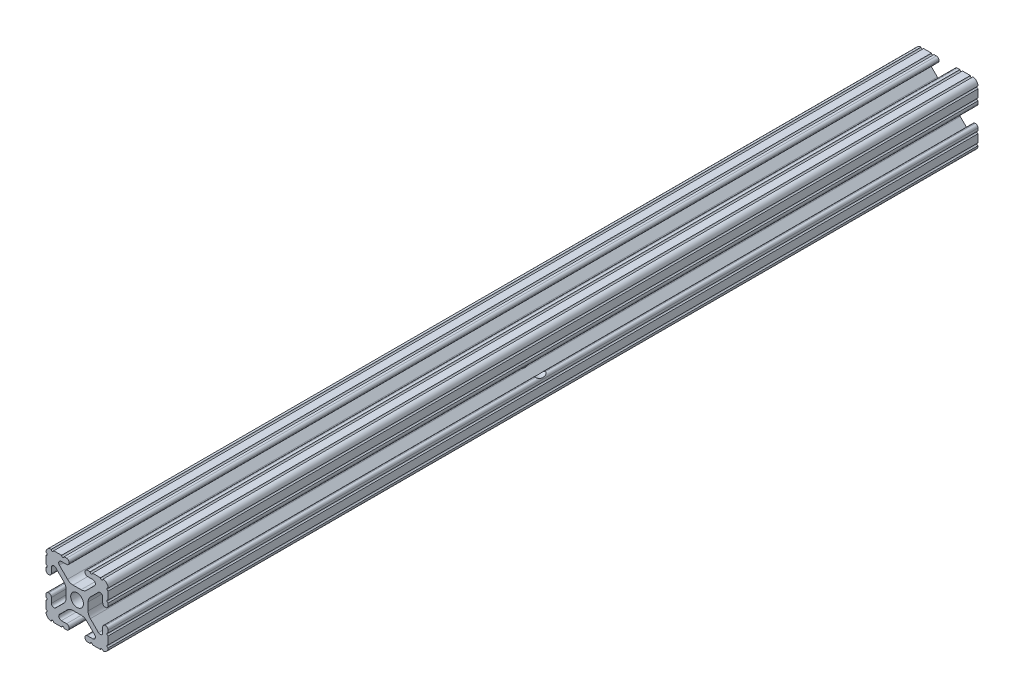
from build123d import *

# Parameters (mm, degrees)
SKETCH1_R               = 2.6035
BOSS_EXTRUDE1_DEPTH     = 177.8
SKETCH2_R               = 3.81
CUT_EXTRUDE1_DEPTH      = 25.4
CUT_EXTRUDE2_DEPTH      = 180.080500267
CUT_EXTRUDE2_DEPTH_BACK = 180.080500267
SKETCH3_R               = 3.175


with BuildPart() as part:
    # Sketch1 → Boss-Extrude1 (new, symmetric)
    with BuildSketch(Plane.XY):
        with BuildLine():
            Line((-7.179650497, -8.645192506), (-3.952270251, -5.423690499))
            ThreePointArc((-3.952270251, -5.423690499), (-2.922936451, -4.736929036), (-1.709253557, -4.4958))
            Line((-1.709253557, -4.4958), (1.709253557, -4.4958))
            ThreePointArc((1.709253557, -4.4958), (2.922936451, -4.736929036), (3.952270251, -5.423690499))
            Line((3.952270251, -5.423690499), (7.179650497, -8.645192506))
            ThreePointArc((7.179650497, -8.645192506), (7.41473083, -9.822813117), (6.416408329, -10.4902))
            Line((6.416408329, -10.4902), (4.287512407, -10.4902))
            ThreePointArc((4.287512407, -10.4902), (3.54574862, -10.79744862), (3.2385, -11.539212407))
            Line((3.2385, -11.539212407), (3.2385, -11.650987593))
            ThreePointArc((3.2385, -11.650987593), (3.54574862, -12.39275138), (4.287512407, -12.7))
            Line((4.287512407, -12.7), (5.317126718, -12.7))
            ThreePointArc((5.317126718, -12.7), (5.825126718, -12.192), (6.333126718, -12.7))
            Line((6.333126718, -12.7), (9.550443118, -12.7))
            ThreePointArc((9.550443118, -12.7), (10.058366869, -12.192000006), (10.566443095, -12.699847501))
            ThreePointArc((10.566443095, -12.699847501), (12.082537762, -12.08250727), (12.699846982, -10.566399977))
            ThreePointArc((12.699846982, -10.566399977), (12.192000006, -10.058323491), (12.7, -9.5504))
            Line((12.7, -9.5504), (12.7, -6.3330836))
            ThreePointArc((12.7, -6.3330836), (12.192, -5.8250836), (12.7, -5.3170836))
            Line((12.7, -5.3170836), (12.7, -4.287469289))
            ThreePointArc((12.7, -4.287469289), (12.39275138, -3.545705502), (11.650987593, -3.238456882))
            Line((11.650987593, -3.238456882), (11.539212407, -3.238456882))
            ThreePointArc((11.539212407, -3.238456882), (10.79744862, -3.545705502), (10.4902, -4.287469289))
            Line((10.4902, -4.287469289), (10.4902, -6.402089023))
            ThreePointArc((10.4902, -6.402089023), (9.856505071, -7.351067942), (8.737131347, -7.129408934))
            Line((8.737131347, -7.129408934), (5.441005833, -3.840816462))
            ThreePointArc((5.441005833, -3.840816462), (4.750877967, -2.809883091), (4.5085, -1.593185507))
            Line((4.5085, -1.593185507), (4.5085, 1.593185507))
            ThreePointArc((4.5085, 1.593185507), (4.750877967, 2.809883091), (5.441005833, 3.840816462))
            Line((5.441005833, 3.840816462), (8.737131347, 7.129408934))
            ThreePointArc((8.737131347, 7.129408934), (9.856505071, 7.351067942), (10.4902, 6.402089023))
            Line((10.4902, 6.402089023), (10.4902, 4.287469289))
            ThreePointArc((10.4902, 4.287469289), (10.79744862, 3.545705502), (11.539212407, 3.238456882))
            Line((11.539212407, 3.238456882), (11.650987593, 3.238456882))
            ThreePointArc((11.650987593, 3.238456882), (12.39275138, 3.545705502), (12.7, 4.287469289))
            Line((12.7, 4.287469289), (12.7, 5.3170836))
            ThreePointArc((12.7, 5.3170836), (12.192, 5.8250836), (12.7, 6.3330836))
            Line((12.7, 6.3330836), (12.7, 9.5504))
            ThreePointArc((12.7, 9.5504), (12.192000006, 10.058323491), (12.699846982, 10.566399977))
            ThreePointArc((12.699846982, 10.566399977), (12.082537762, 12.08250727), (10.566443095, 12.699847501))
            ThreePointArc((10.566443095, 12.699847501), (10.058366869, 12.192000006), (9.550443118, 12.7))
            Line((9.550443118, 12.7), (6.333126718, 12.7))
            ThreePointArc((6.333126718, 12.7), (5.825126718, 12.192), (5.317126718, 12.7))
            Line((5.317126718, 12.7), (4.287512407, 12.7))
            ThreePointArc((4.287512407, 12.7), (3.54574862, 12.39275138), (3.2385, 11.650987593))
            Line((3.2385, 11.650987593), (3.2385, 11.539212407))
            ThreePointArc((3.2385, 11.539212407), (3.54574862, 10.79744862), (4.287512407, 10.4902))
            Line((4.287512407, 10.4902), (6.476788598, 10.4902))
            ThreePointArc((6.476788598, 10.4902), (7.432222385, 9.85140422), (7.207036008, 8.724370562))
            Line((7.207036008, 8.724370562), (3.898272566, 5.423169045))
            ThreePointArc((3.898272566, 5.423169045), (2.869120213, 4.736787962), (1.655778399, 4.4958))
            Line((1.655778399, 4.4958), (-1.655778399, 4.4958))
            ThreePointArc((-1.655778399, 4.4958), (-2.869120213, 4.736787962), (-3.898272566, 5.423169045))
            Line((-3.898272566, 5.423169045), (-7.207036008, 8.724370562))
            ThreePointArc((-7.207036008, 8.724370562), (-7.432222385, 9.85140422), (-6.476788598, 10.4902))
            Line((-6.476788598, 10.4902), (-4.287512407, 10.4902))
            ThreePointArc((-4.287512407, 10.4902), (-3.54574862, 10.79744862), (-3.2385, 11.539212407))
            Line((-3.2385, 11.539212407), (-3.2385, 11.650987593))
            ThreePointArc((-3.2385, 11.650987593), (-3.54574862, 12.39275138), (-4.287512407, 12.7))
            Line((-4.287512407, 12.7), (-5.317126718, 12.7))
            ThreePointArc((-5.317126718, 12.7), (-5.825126718, 12.192), (-6.333126718, 12.7))
            Line((-6.333126718, 12.7), (-9.550443118, 12.7))
            ThreePointArc((-9.550443118, 12.7), (-10.058366869, 12.192000006), (-10.566443095, 12.699847501))
            ThreePointArc((-10.566443095, 12.699847501), (-12.082537762, 12.08250727), (-12.699846982, 10.566399977))
            ThreePointArc((-12.699846982, 10.566399977), (-12.192000006, 10.058323491), (-12.7, 9.5504))
            Line((-12.7, 9.5504), (-12.7, 6.3330836))
            ThreePointArc((-12.7, 6.3330836), (-12.192, 5.8250836), (-12.7, 5.3170836))
            Line((-12.7, 5.3170836), (-12.7, 4.287469289))
            ThreePointArc((-12.7, 4.287469289), (-12.39275138, 3.545705502), (-11.650987593, 3.238456882))
            Line((-11.650987593, 3.238456882), (-11.539212407, 3.238456882))
            ThreePointArc((-11.539212407, 3.238456882), (-10.79744862, 3.545705502), (-10.4902, 4.287469289))
            Line((-10.4902, 4.287469289), (-10.4902, 6.402089023))
            ThreePointArc((-10.4902, 6.402089023), (-9.856505071, 7.351067942), (-8.737131347, 7.129408934))
            Line((-8.737131347, 7.129408934), (-5.441005833, 3.840816462))
            ThreePointArc((-5.441005833, 3.840816462), (-4.750877967, 2.809883091), (-4.5085, 1.593185507))
            Line((-4.5085, 1.593185507), (-4.5085, -1.593185507))
            ThreePointArc((-4.5085, -1.593185507), (-4.750877967, -2.809883091), (-5.441005833, -3.840816462))
            Line((-5.441005833, -3.840816462), (-8.737131347, -7.129408934))
            ThreePointArc((-8.737131347, -7.129408934), (-9.856505071, -7.351067942), (-10.4902, -6.402089023))
            Line((-10.4902, -6.402089023), (-10.4902, -4.287469289))
            ThreePointArc((-10.4902, -4.287469289), (-10.79744862, -3.545705502), (-11.539212407, -3.238456882))
            Line((-11.539212407, -3.238456882), (-11.650987593, -3.238456882))
            ThreePointArc((-11.650987593, -3.238456882), (-12.39275138, -3.545705502), (-12.7, -4.287469289))
            Line((-12.7, -4.287469289), (-12.7, -5.3170836))
            ThreePointArc((-12.7, -5.3170836), (-12.192, -5.8250836), (-12.7, -6.3330836))
            Line((-12.7, -6.3330836), (-12.7, -9.5504))
            ThreePointArc((-12.7, -9.5504), (-12.192000006, -10.058323491), (-12.699846982, -10.566399977))
            ThreePointArc((-12.699846982, -10.566399977), (-12.082537762, -12.08250727), (-10.566443095, -12.699847501))
            ThreePointArc((-10.566443095, -12.699847501), (-10.058366869, -12.192000006), (-9.550443118, -12.7))
            Line((-9.550443118, -12.7), (-6.333126718, -12.7))
            ThreePointArc((-6.333126718, -12.7), (-5.825126718, -12.192), (-5.317126718, -12.7))
            Line((-5.317126718, -12.7), (-4.287512407, -12.7))
            ThreePointArc((-4.287512407, -12.7), (-3.54574862, -12.39275138), (-3.2385, -11.650987593))
            Line((-3.2385, -11.650987593), (-3.2385, -11.539212407))
            ThreePointArc((-3.2385, -11.539212407), (-3.54574862, -10.79744862), (-4.287512407, -10.4902))
            Line((-4.287512407, -10.4902), (-6.416408329, -10.4902))
            ThreePointArc((-6.416408329, -10.4902), (-7.41473083, -9.822813117), (-7.179650497, -8.645192506))
        make_face()
        Circle(SKETCH1_R, mode=Mode.SUBTRACT)
    extrude(amount=BOSS_EXTRUDE1_DEPTH, both=True)

    # Sketch2 → Cut-Extrude1 (cut)
    with BuildSketch(Plane.ZY.offset(12.7)):
        Circle(SKETCH2_R)
    extrude(amount=-CUT_EXTRUDE1_DEPTH, mode=Mode.SUBTRACT)

    # Sketch3 → Cut-Extrude2 (cut, two sides: drawn at the far end of the back side and taken through both)
    with BuildSketch(Plane(origin=(0, 4.4958, 0), x_dir=(1, 0, 0), z_dir=(0, 1, 0)).offset(-CUT_EXTRUDE2_DEPTH_BACK)):
        with Locations((0, -165.1)):
            Circle(SKETCH3_R)
        with Locations((0, 165.1)):
            Circle(SKETCH3_R)
    extrude(amount=CUT_EXTRUDE2_DEPTH + CUT_EXTRUDE2_DEPTH_BACK, mode=Mode.SUBTRACT)


solid = part.part
